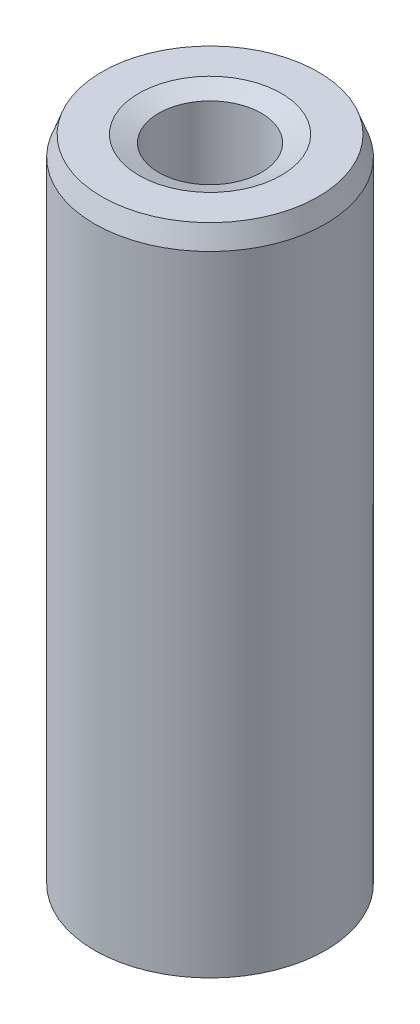
from build123d import *
from OCP.BRepFilletAPI import BRepFilletAPI_MakeChamfer

# Parameters (mm, degrees)
SKETCH1_R           = 7.5
BOSS_EXTRUDE1_DEPTH = 42.599878342
SKETCH2_R           = 3.333760618
CUT_EXTRUDE1_DEPTH  = 44.900451419
CHAMFER1_SIZE       = 1.286209409
CHAMFER1_SIZE2      = 0.47816276


with BuildPart() as part:
    # Sketch1 → Boss-Extrude1 (new body)
    with BuildSketch(Plane(origin=(0, 0, 0), x_dir=(1, 0, 0), z_dir=(0, 1, 0))):
        Circle(SKETCH1_R)
    extrude(amount=BOSS_EXTRUDE1_DEPTH)

    # Sketch2 → Cut-Extrude1 (cut, through all)
    with BuildSketch(Plane(origin=(0, 0, 0), x_dir=(1, 0, 0), z_dir=(0, 1, 0))):
        Circle(SKETCH2_R)
    extrude(amount=CUT_EXTRUDE1_DEPTH, mode=Mode.SUBTRACT)

    # Chamfer1: one chamfer whose edges measure the first distance from different faces: ONE call of the kernel's chamfer builder (chamfer() names one face for all edges)
    chamfer1_edges_1 = [part.edges().sort_by_distance(p)[0] for p in [
        (-3.333760618, 42.599878342, 0),
    ]]
    chamfer1_side_1 = [part.faces().sort_by_distance(p)[0] for p in [
        (-7.287867966, 42.599878342, 0),
    ]]
    chamfer1_edges_2 = [part.edges().sort_by_distance(p)[0] for p in [
        (-3.333760618, 0, 0),
    ]]
    chamfer1_side_2 = [part.faces().sort_by_distance(p)[0] for p in [
        (-3.333760618, 21.299939171, 0),
    ]]
    chamfer1_edges_3 = [part.edges().sort_by_distance(p)[0] for p in [
        (-7.5, 0, 0),
    ]]
    chamfer1_side_3 = [part.faces().sort_by_distance(p)[0] for p in [
        (-7.287867966, 0, 0),
    ]]
    chamfer1_edges_4 = [part.edges().sort_by_distance(p)[0] for p in [
        (-7.5, 42.599878342, 0),
    ]]
    chamfer1_side_4 = [part.faces().sort_by_distance(p)[0] for p in [
        (-7.5, 21.299939171, 0),
    ]]
    chamfer1 = BRepFilletAPI_MakeChamfer(part.part.solid().wrapped)
    for e in chamfer1_edges_1:
        chamfer1.Add(CHAMFER1_SIZE, CHAMFER1_SIZE2, e.wrapped, chamfer1_side_1[0].wrapped)  # the first distance lies on this face
    for e in chamfer1_edges_2:
        chamfer1.Add(CHAMFER1_SIZE, CHAMFER1_SIZE2, e.wrapped, chamfer1_side_2[0].wrapped)  # the first distance lies on this face
    for e in chamfer1_edges_3:
        chamfer1.Add(CHAMFER1_SIZE, CHAMFER1_SIZE2, e.wrapped, chamfer1_side_3[0].wrapped)  # the first distance lies on this face
    for e in chamfer1_edges_4:
        chamfer1.Add(CHAMFER1_SIZE, CHAMFER1_SIZE2, e.wrapped, chamfer1_side_4[0].wrapped)  # the first distance lies on this face
    add(Compound.cast(chamfer1.Shape()), mode=Mode.REPLACE)


solid = part.part
